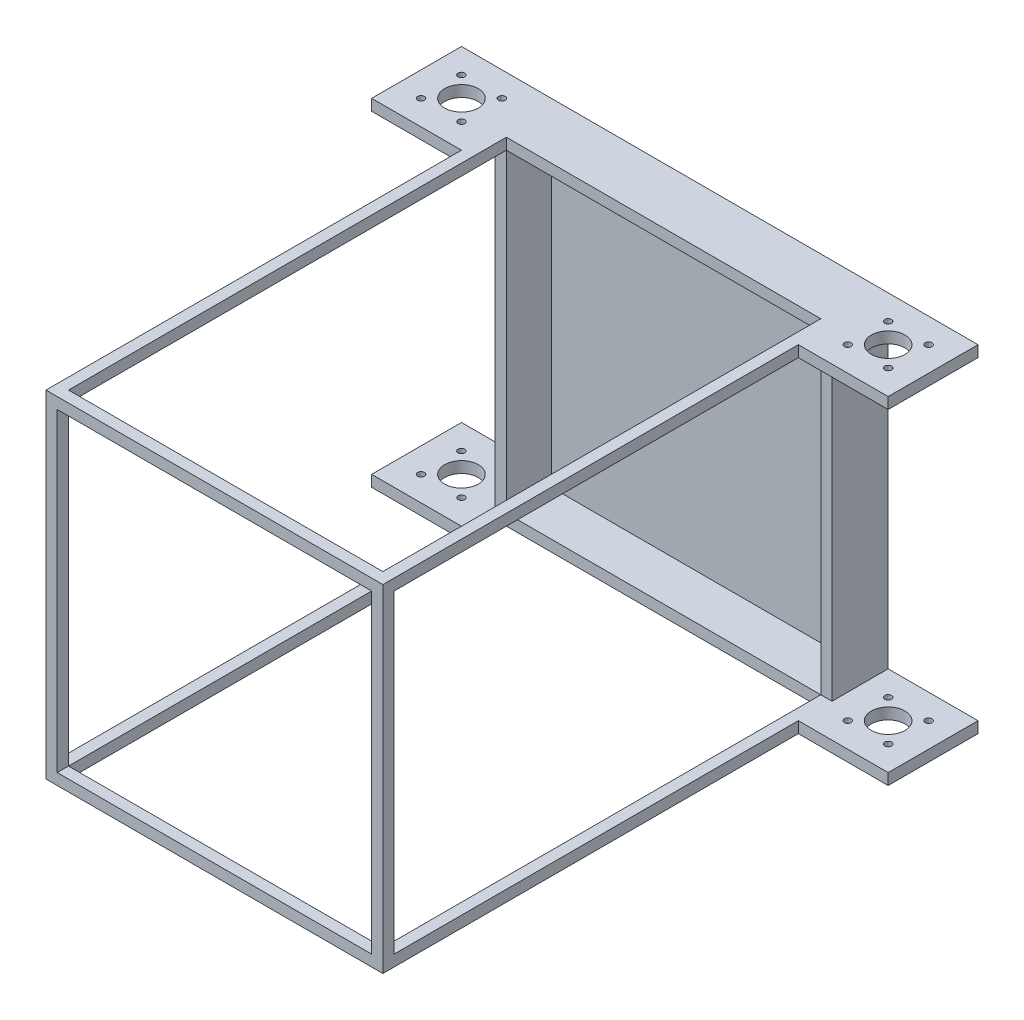
from build123d import *

# Parameters (mm, degrees)
SKETCH_1_W                  = 140
SKETCH_1_H                  = 140
EXTRUDE_2_DEPTH             = 5
SKETCH_1_4_W                = 40
SKETCH_1_4_H                = 5
EXTRUDE_3_DEPTH             = 20
SKETCH_2_R                  = 7.5
SKETCH_2_R_2                = 1.5
CUT_EXTRUDE_1_DEPTH         = 243.89915603
PATTERN_LINEAR_1_COUNT      = 2
PATTERN_LINEAR_1_PITCH      = 190
SKETCH_4_W                  = 5
SKETCH_4_H                  = 5
EXTRUDE_5_DEPTH             = 200
PATTERN_LINEAR_2_COUNT      = 2
PATTERN_LINEAR_2_PITCH      = 145
PATTERN_LINEAR_2_COUNT_DIR2 = 2
PATTERN_LINEAR_2_PITCH_DIR2 = 145
PATTERN_LINEAR_3_COUNT      = 2
PATTERN_LINEAR_3_PITCH      = 200
SKETCH_5_W                  = 150
SKETCH_5_H                  = 150
EXTRUDE_6_DEPTH             = 20
SKETCH_7_W                  = 140
SKETCH_7_H                  = 140
CUT_EXTRUDE_3_DEPTH         = 15


with BuildPart() as part:
    # Эскиз1 → Бобышка-Вытянуть2 (new body)
    with BuildSketch(Plane.XY):
        Polygon((150, 150), (0, 150), (0, 145), (0, 5), (0, 0), (150, 0), (150, 5), (150, 145), align=None)
        with Locations((75, 75)):
            Rectangle(SKETCH_1_W, SKETCH_1_H, mode=Mode.SUBTRACT)
    extrude_2 = extrude(amount=EXTRUDE_2_DEPTH)

    # Эскиз1<4> → Бобышка-Вытянуть3 (add, symmetric)
    with BuildSketch(Plane.XY):
        with Locations((170, 147.5)):
            Rectangle(SKETCH_1_4_W, SKETCH_1_4_H)
        with Locations((-20, 147.5)):
            Rectangle(SKETCH_1_4_W, SKETCH_1_4_H)
        with Locations((170, 2.5)):
            Rectangle(SKETCH_1_4_W, SKETCH_1_4_H)
        with Locations((-20, 2.5)):
            Rectangle(SKETCH_1_4_W, SKETCH_1_4_H)
    extrude(amount=EXTRUDE_3_DEPTH, both=True)

    # Эскиз2 → Вырез-Вытянуть1 (cut, through all)
    with BuildSketch(Plane.XZ):
        with Locations((-20, 0)):
            Circle(SKETCH_2_R)
        with Locations((-29, 9)):
            Circle(SKETCH_2_R_2)
        with Locations((-29, -9)):
            Circle(SKETCH_2_R_2)
        with Locations((-11, -9)):
            Circle(SKETCH_2_R_2)
        with Locations((-11, 9)):
            Circle(SKETCH_2_R_2)
    cut_extrude_1 = extrude(amount=-CUT_EXTRUDE_1_DEPTH, mode=Mode.SUBTRACT)

    # Линейный массив1: Вырез-Вытянуть1 ×2
    with Locations(*[(i * PATTERN_LINEAR_1_PITCH, 0, 0) for i in range(1, PATTERN_LINEAR_1_COUNT)]):
        add(cut_extrude_1, mode=Mode.SUBTRACT)

    # Эскиз4 → Бобышка-Вытянуть5 (add)
    with BuildSketch(Plane.XY.offset(5)):
        with Locations((147.5, 2.5)):
            Rectangle(SKETCH_4_W, SKETCH_4_H)
    extrude_5 = extrude(amount=EXTRUDE_5_DEPTH)

    # Линейный массив2: Extrude 5 2 × 2
    with Locations(*[(-j * PATTERN_LINEAR_2_PITCH_DIR2, i * PATTERN_LINEAR_2_PITCH, 0) for i in range(PATTERN_LINEAR_2_COUNT) for j in range(PATTERN_LINEAR_2_COUNT_DIR2) if (i, j) != (0, 0)]):
        add(extrude_5)

    # Линейный массив3: Бобышка-Вытянуть2 ×2
    with Locations(*[(0, 0, i * PATTERN_LINEAR_3_PITCH) for i in range(1, PATTERN_LINEAR_3_COUNT)]):
        add(extrude_2)

    # Эскиз5 → Бобышка-Вытянуть6 (add)
    with BuildSketch(Plane(origin=(0, 0, 0), x_dir=(-1, 0, 0), z_dir=(0, 0, -1))):
        with Locations((-75, 75)):
            Rectangle(SKETCH_5_W, SKETCH_5_H)
    extrude(amount=EXTRUDE_6_DEPTH)

    # Эскиз7 → Вырез-Вытянуть3 (cut)
    with BuildSketch(Plane.XY):
        with Locations((75, 75)):
            Rectangle(SKETCH_7_W, SKETCH_7_H)
    extrude(amount=-CUT_EXTRUDE_3_DEPTH, mode=Mode.SUBTRACT)


solid = part.part
